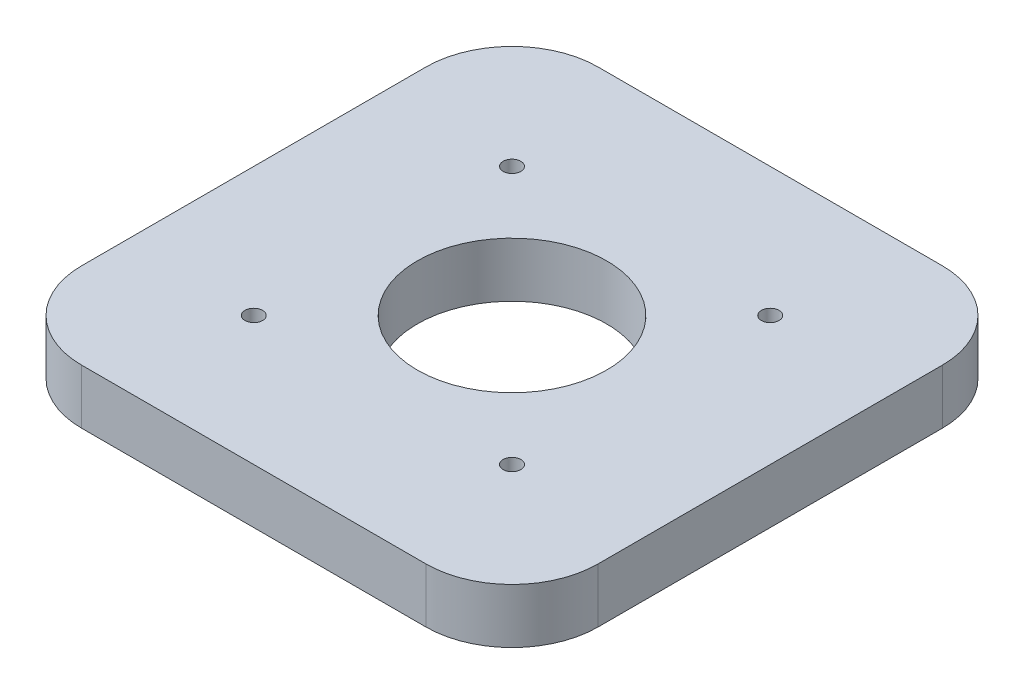
from build123d import *

# Parameters (mm, degrees)
SKETCH3_W           = 60
SKETCH3_H           = 60
SKETCH3_R           = 11
SKETCH3_R_2         = 1.025
BOSS_EXTRUDE1_DEPTH = 6.35
FILLET1_R           = 10


with BuildPart() as part:
    # Sketch3 → Boss-Extrude1 (new body)
    with BuildSketch(Plane(origin=(0, 0, 0), x_dir=(1, 0, 0), z_dir=(0, 1, 0))):
        with Locations((70, -76.67036626)):
            Rectangle(SKETCH3_W, SKETCH3_H)
        with Locations((70, -76.67036626)):
            Circle(SKETCH3_R, mode=Mode.SUBTRACT)
        with Locations((55, -61.67036626)):
            Circle(SKETCH3_R_2, mode=Mode.SUBTRACT)
        with Locations((85, -61.67036626)):
            Circle(SKETCH3_R_2, mode=Mode.SUBTRACT)
        with Locations((85, -91.67036626)):
            Circle(SKETCH3_R_2, mode=Mode.SUBTRACT)
        with Locations((55, -91.67036626)):
            Circle(SKETCH3_R_2, mode=Mode.SUBTRACT)
    extrude(amount=BOSS_EXTRUDE1_DEPTH)

    # Fillet1
    fillet1_edges = [part.edges().sort_by_distance(p)[0] for p in [
        (100, 3.175, 106.67036626),
        (100, 3.175, 46.67036626),
        (40, 3.175, 46.67036626),
        (40, 3.175, 106.67036626),
    ]]
    fillet(fillet1_edges, radius=FILLET1_R)


solid = part.part
